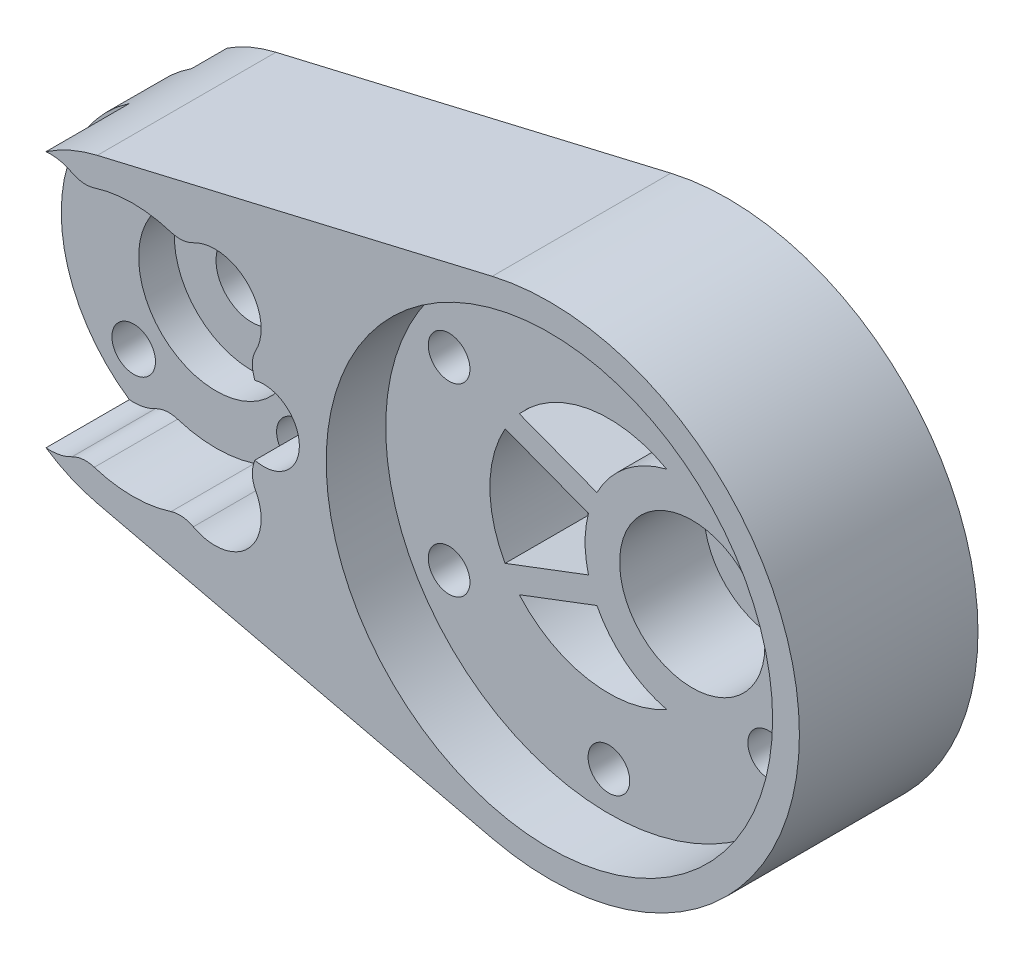
from build123d import *

# Parameters (mm, degrees)
BOSS_EXTRUDE1_DEPTH          = 15
SKETCH6_R                    = 3
SKETCH6_R_2                  = 1.8288
HUB_MOUNT_HOLE_PATTERN_DEPTH = 62.660360038
SKETCH7_R                    = 1.75
SKETCH7_R_2                  = 3.25
MOTOR_HOLE_PATTERN_DEPTH     = 62.660360038
SKETCH8_R                    = 18.75
MOTOR_CUTOUT_DEPTH           = 5
HUB_START                    = -7
HUB_MOUNT_CUTOUT_DEPTH       = 7
SKETCH10_R                   = 5
BOSS_EXTRUDE2_DEPTH          = 5.5
LINKAGE_PIN_HOLE_DEPTH       = 62.660360038
LINKAGE_PIN_HOLE_DEPTH_BACK  = 62.660360038
SKETCH12_R                   = 1.55
CHAMFER1_SIZE                = 2.75
SKETCH13_R                   = 6.1
CUT_EXTRUDE7_DEPTH           = 7.1
SKETCH14_R                   = 6.5
CUT_EXTRUDE8_DEPTH           = 3
SKETCH15_R                   = 3.5
CUT_EXTRUDE9_DEPTH           = 5
CUT_EXTRUDE10_DEPTH          = 62.312722986
CUT_EXTRUDE10_DEPTH_BACK     = 3
SKETCH16_R                   = 3
CUT_EXTRUDE12_DEPTH          = 7
BOSS_EXTRUDE3_REACH          = 63.784
CUT_EXTRUDE13_DEPTH          = 62.660360038
CUT_EXTRUDE13_DEPTH_BACK     = 3
SKETCH19_R                   = 4
FILLET1_R                    = 5


with BuildPart() as part:
    # Sketch2 → Boss-Extrude1 (new body)
    with BuildSketch(Plane.XY):
        with BuildLine():
            Line((-2.971428571, 12.655852885), (30.2, 20.444070045))
            ThreePointArc((30.2, 20.444070045), (56, 0), (30.2, -20.444070045))
            Line((30.2, -20.444070045), (-2.971428571, -12.655852885))
            ThreePointArc((-2.971428571, -12.655852885), (-13, 0), (-2.971428571, 12.655852885))
        make_face()
    extrude(amount=BOSS_EXTRUDE1_DEPTH)

    # Sketch6 → hub mount hole pattern (cut, through all)
    with BuildSketch(Plane.XY.offset(15)):
        Circle(SKETCH6_R)
        with Locations((-6.914797213, 6.914797213)):
            Circle(SKETCH6_R_2)
        with Locations((6.914797213, 6.914797213)):
            Circle(SKETCH6_R_2)
        with Locations((6.914797213, -6.914797213)):
            Circle(SKETCH6_R_2)
        with Locations((-6.914797213, -6.914797213)):
            Circle(SKETCH6_R_2)
    extrude(amount=-HUB_MOUNT_HOLE_PATTERN_DEPTH, mode=Mode.SUBTRACT)

    # Sketch7 → motor hole pattern (cut, through all)
    with BuildSketch(Plane.XY.offset(15)):
        with Locations((21.576606241, 7.75)):
            Circle(SKETCH7_R)
        with Locations((35, 15.5)):
            Circle(SKETCH7_R)
        with Locations((48.423393759, 7.75)):
            Circle(SKETCH7_R)
        with Locations((48.423393759, -7.75)):
            Circle(SKETCH7_R)
        with Locations((35, -15.5)):
            Circle(SKETCH7_R)
        with Locations((21.576606241, -7.75)):
            Circle(SKETCH7_R)
        with Locations((42, 0)):
            Circle(SKETCH7_R_2)
    extrude(amount=-MOTOR_HOLE_PATTERN_DEPTH, mode=Mode.SUBTRACT)

    # Sketch8 → motor cutout (cut)
    with BuildSketch(Plane.XY.offset(15)):
        with Locations((35, 0)):
            Circle(SKETCH8_R)
    extrude(amount=-MOTOR_CUTOUT_DEPTH, mode=Mode.SUBTRACT)

    # Sketch9 → hub mount cutout (cut)
    with BuildSketch(Plane.XY.offset(15).offset(HUB_START)):
        with BuildLine():
            ThreePointArc((-7.281143007, 10.769631215), (-13, 0), (-7.281143007, -10.769631215))
            ThreePointArc((-7.281143007, -10.769631215), (-6.15529138, -10.711783559), (-5.093815501, -10.332103173))
            ThreePointArc((-5.093815501, -10.332103173), (-4.17580433, -10.057753531), (-3.223255475, -10.161014917))
            ThreePointArc((-3.223255475, -10.161014917), (0, -10.66), (3.223255475, -10.161014917))
            ThreePointArc((3.223255475, -10.161014917), (4.17580433, -10.057753531), (5.093815501, -10.332103173))
            ThreePointArc((5.093815501, -10.332103173), (9.652858062, -9.652858062), (10.332103173, -5.093815501))
            ThreePointArc((10.332103173, -5.093815501), (10.057753531, -4.17580433), (10.161014917, -3.223255475))
            ThreePointArc((10.161014917, -3.223255475), (10.66, 0), (10.161014917, 3.223255475))
            ThreePointArc((10.161014917, 3.223255475), (10.057753531, 4.17580433), (10.332103173, 5.093815501))
            ThreePointArc((10.332103173, 5.093815501), (9.652858062, 9.652858062), (5.093815501, 10.332103173))
            ThreePointArc((5.093815501, 10.332103173), (4.17580433, 10.057753531), (3.223255475, 10.161014917))
            ThreePointArc((3.223255475, 10.161014917), (0, 10.66), (-3.223255475, 10.161014917))
            ThreePointArc((-3.223255475, 10.161014917), (-4.17580433, 10.057753531), (-5.093815501, 10.332103173))
            ThreePointArc((-5.093815501, 10.332103173), (-6.15529138, 10.711783559), (-7.281143007, 10.769631215))
        make_face()
    extrude(amount=HUB_MOUNT_CUTOUT_DEPTH, mode=Mode.SUBTRACT)

    # Sketch10 → Boss-Extrude2 (add)
    with BuildSketch(Plane(origin=(0, 0, 0), x_dir=(-1, 0, 0), z_dir=(0, 0, -1))):
        with Locations(Location((-11, 0, 0), (0, 0, 180))):
            Circle(SKETCH10_R)
    extrude(amount=BOSS_EXTRUDE2_DEPTH)

    # Sketch12 → Linkage pin hole (cut, two sides: drawn at the far end of the back side and taken through both)
    with BuildSketch(Plane.XY.offset(-LINKAGE_PIN_HOLE_DEPTH_BACK)):
        with Locations((11, 0)):
            Circle(SKETCH12_R)
    extrude(amount=LINKAGE_PIN_HOLE_DEPTH + LINKAGE_PIN_HOLE_DEPTH_BACK, mode=Mode.SUBTRACT)

    # Chamfer1
    chamfer1_edges = [part.edges().sort_by_distance(p)[0] for p in [
        (6, 0, -5.5),
    ]]
    chamfer(chamfer1_edges, length=CHAMFER1_SIZE)

    # Sketch13 → Cut-Extrude7 (cut)
    with BuildSketch(Plane.XY.offset(10)):
        with Locations((42, 0)):
            Circle(SKETCH13_R)
    extrude(amount=-CUT_EXTRUDE7_DEPTH, mode=Mode.SUBTRACT)

    # Sketch14 → Cut-Extrude8 (cut)
    with BuildSketch(Plane.XY.offset(8)):
        Circle(SKETCH14_R)
    extrude(amount=-CUT_EXTRUDE8_DEPTH, mode=Mode.SUBTRACT)

    # Sketch15 → Cut-Extrude9 (cut)
    with BuildSketch(Plane(origin=(0, 0, 0), x_dir=(-1, 0, 0), z_dir=(0, 0, -1))):
        with Locations((-21.576606241, -7.75)):
            Circle(SKETCH15_R)
        with Locations((-35, -15.5)):
            Circle(SKETCH15_R)
        with Locations((-48.423393759, -7.75)):
            Circle(SKETCH15_R)
        with Locations((-48.423393759, 7.75)):
            Circle(SKETCH15_R)
        with Locations((-35, 15.5)):
            Circle(SKETCH15_R)
        with Locations((-21.576606241, 7.75)):
            Circle(SKETCH15_R)
    extrude(amount=-CUT_EXTRUDE9_DEPTH, mode=Mode.SUBTRACT)

    # Sketch16 → Cut-Extrude10 (cut, two sides: drawn at the far end of the back side and taken through both)
    with BuildSketch(Plane.XY.offset(8).offset(-CUT_EXTRUDE10_DEPTH_BACK)):
        with Locations(Location((11, 0, 0), (0, 0, 104.35596801))):
            Circle(SKETCH16_R)
    extrude(amount=CUT_EXTRUDE10_DEPTH + CUT_EXTRUDE10_DEPTH_BACK, mode=Mode.SUBTRACT)

    # Sketch17 → Cut-Extrude12 (cut)
    with BuildSketch(Plane.XY.offset(10)):
        with BuildLine():
            ThreePointArc((39.857142857, 8.741176309), (25, 0), (39.857142857, -8.741176309))
            ThreePointArc((39.857142857, -8.741176309), (33, 0), (39.857142857, 8.741176309))
        make_face()
    extrude(amount=-CUT_EXTRUDE12_DEPTH, mode=Mode.SUBTRACT)

    # Sketch18 → Boss-Extrude3 (add, up to next)
    with BuildSketch(Plane.XY.offset(10), mode=Mode.PRIVATE) as boss_extrude3_sk1:
        with BuildLine():
            Line((27.471985333, -6.582476371), (33.992343948, -4.108216712))
            ThreePointArc((33.992343948, -4.108216712), (33.585458911, -3.193039032), (33.282779719, -2.238318693))
            Line((33.282779719, -2.238318693), (26.280269544, -4.895538864))
            ThreePointArc((26.280269544, -4.895538864), (26.83245784, -5.769857456), (27.471985333, -6.582476371))
        make_face()
    boss_extrude3_tool1 = extrude(boss_extrude3_sk1.sketch, amount=-BOSS_EXTRUDE3_REACH, mode=Mode.PRIVATE) - part.part
    # Sketch18 → Boss-Extrude3 (add, up to next)
    with BuildSketch(Plane.XY.offset(10), mode=Mode.PRIVATE) as boss_extrude3_sk2:
        with BuildLine():
            Line((27.471985333, 6.582476371), (33.992343948, 4.108216712))
            ThreePointArc((33.992343948, 4.108216712), (33.585458911, 3.193039032), (33.282779719, 2.238318693))
            Line((33.282779719, 2.238318693), (26.280269544, 4.895538864))
            ThreePointArc((26.280269544, 4.895538864), (26.83245784, 5.769857456), (27.471985333, 6.582476371))
        make_face()
    boss_extrude3_tool2 = extrude(boss_extrude3_sk2.sketch, amount=-BOSS_EXTRUDE3_REACH, mode=Mode.PRIVATE) - part.part
    add(boss_extrude3_tool1.solids().sort_by_distance((30.216616, -4.45872, 10))[0])
    add(boss_extrude3_tool2.solids().sort_by_distance((30.216616, 4.45872, 10))[0])

    # Sketch19 → Cut-Extrude13 (cut, two sides: drawn at the far end of the back side and taken through both)
    with BuildSketch(Plane(origin=(0, 0, 0), x_dir=(-1, 0, 0), z_dir=(0, 0, -1)).offset(-CUT_EXTRUDE13_DEPTH_BACK)):
        with Locations(Location((-6.914797213, -6.914797213, 0), (0, 0, 90.325769881))):
            Circle(SKETCH19_R)
        with Locations(Location((-6.914797213, 6.914797213, 0), (0, 0, 269.674230119))):
            Circle(SKETCH19_R)
        with Locations((6.914797213, 6.914797213)):
            Circle(SKETCH19_R)
        with Locations((6.914797213, -6.914797213)):
            Circle(SKETCH19_R)
    extrude(amount=CUT_EXTRUDE13_DEPTH + CUT_EXTRUDE13_DEPTH_BACK, mode=Mode.SUBTRACT)

    # Fillet1
    # the kernel refuses this fillet: 5 mm, written as the material it adds along each edge
    with BuildSketch(Plane(origin=(11, 0, 0), x_dir=(-0.9999950652018581, 0.003141587485879405, 0), z_dir=(-0.003141587485879405, -0.9999950652018581, 0))) as fillet1_piece_1_section:
        with BuildLine():
            CenterArc((9.465142775, 5), FILLET1_R, 206.74368395, 63.25631605)
            Line((9.465142775, 0), (9.465142775, -0.1))
            Line((9.465142775, -0.1), (5, -0.1))
            Line((5, -0.1), (4.9, 0))
            ThreePointArc((4.9, 0), (4.9, 1.375), (4.910697145, 2.705))
            Line((4.910697145, 2.705), (5, 2.75))
        make_face()
    fillet1_piece_1 = revolve(axis=Axis((11, 0, 0), (0, 0, -1)), revolution_arc=359.64, mode=Mode.PRIVATE)
    fillet1_piece_1 = fillet1_piece_1 - Plane(origin=(6.914797213, -6.914797213, -0.762875984), x_dir=(0.0056857263926290095, 0.9999838361270588, 0), z_dir=(0, 0, 1)) * Cylinder(4, 38, mode=Mode.PRIVATE)
    fillet1_piece_1 = fillet1_piece_1 - Plane(origin=(6.914797213, 6.914797213, -0.762875984), x_dir=(0.00568572639262881, -0.9999838361270588, 0), z_dir=(0, 0, 1)) * Cylinder(4, 38, mode=Mode.PRIVATE)
    fillet1_piece_1 = fillet1_piece_1 - Plane(origin=(0, 0, -0.762875984), x_dir=(1, 0, 0), z_dir=(0, 0, 1)) * Cylinder(3, 38, mode=Mode.PRIVATE)
    add(fillet1_piece_1)
    with BuildSketch(Plane(origin=(11, 0, 0), x_dir=(0.9593586032510993, -0.2821897772211103, 0), z_dir=(0.2821897772211103, 0.9593586032510993, 0))) as fillet1_piece_2_section:
        with BuildLine():
            CenterArc((9.465142775, 5), FILLET1_R, 206.74368395, 63.25631605)
            Line((9.465142775, 0), (9.465142775, -0.1))
            Line((9.465142775, -0.1), (5, -0.1))
            Line((5, -0.1), (4.9, 0))
            ThreePointArc((4.9, 0), (4.9, 1.375), (4.910697145, 2.705))
            Line((4.910697145, 2.705), (5, 2.75))
        make_face()
    fillet1_piece_2 = revolve(axis=Axis((11, 0, 0), (0, 0, -1)), revolution_arc=327.218117947, mode=Mode.PRIVATE)
    fillet1_piece_2 = fillet1_piece_2 - Plane(origin=(6.914797213, -6.914797213, -0.749324739), x_dir=(0.0056857263926290095, 0.9999838361270588, 0), z_dir=(0, 0, 1)) * Cylinder(4, 38, mode=Mode.PRIVATE)
    fillet1_piece_2 = fillet1_piece_2 - Plane(origin=(6.914797213, 6.914797213, -0.749324739), x_dir=(0.00568572639262881, -0.9999838361270588, 0), z_dir=(0, 0, 1)) * Cylinder(4, 38, mode=Mode.PRIVATE)
    fillet1_piece_2 = fillet1_piece_2 - Plane(origin=(0, 0, -0.749324739), x_dir=(1, 0, 0), z_dir=(0, 0, 1)) * Cylinder(3, 38, mode=Mode.PRIVATE)
    add(fillet1_piece_2)


solid = part.part
